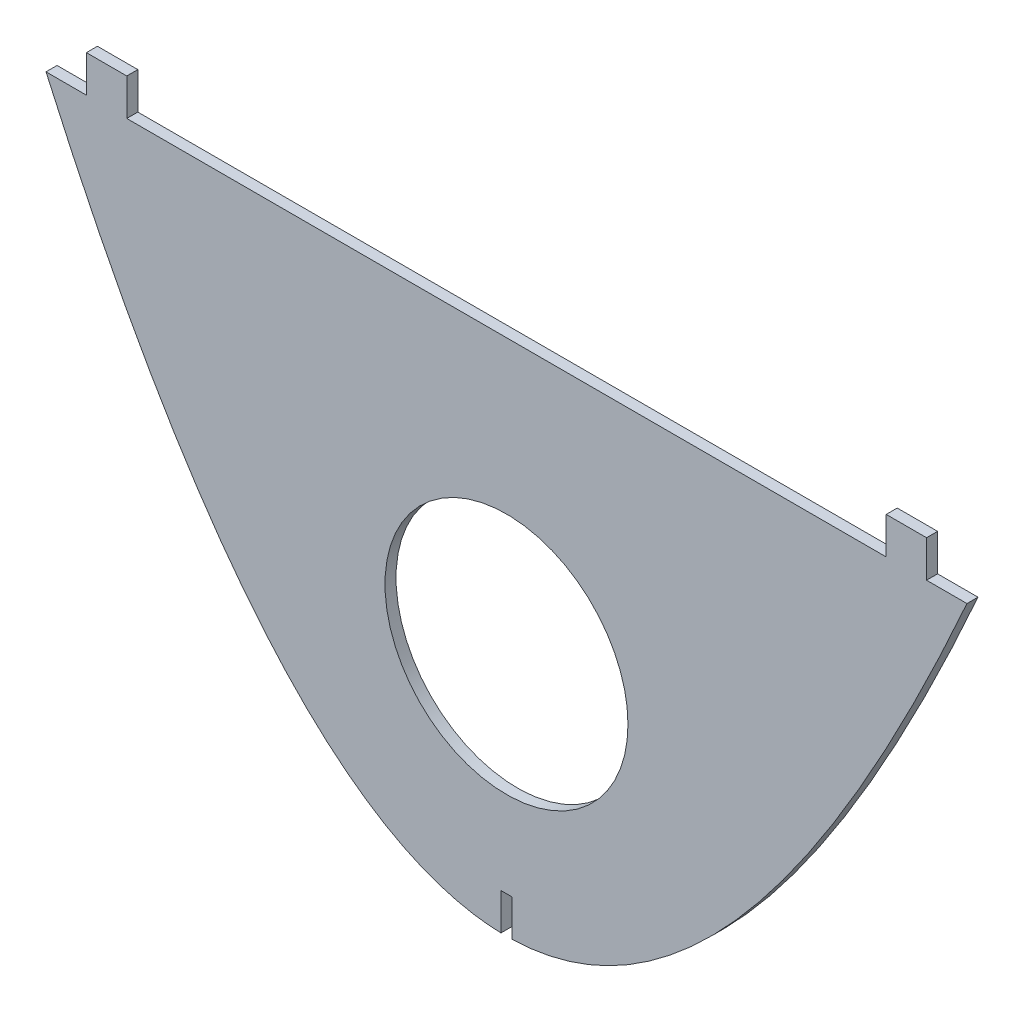
from build123d import *

# Parameters (mm, degrees)
BOSS_EXTRUDE1_DEPTH = 3
SKETCH2_W           = 3
SKETCH2_H           = 14.324437629
CUT_EXTRUDE1_DEPTH  = 13
SKETCH3_R           = 33
CUT_EXTRUDE2_DEPTH  = 196.94408514


with BuildPart() as part:
    # Sketch1 → Boss-Extrude1 (new body)
    with BuildSketch(Plane.XY):
        with BuildLine():
            Line((-125.077753597, 140.800000003), (-114.108233468, 140.800000003))
            Line((-114.108233468, 140.800000003), (-114.108233468, 150.800000003))
            Line((-114.108233468, 150.800000003), (-103.138713339, 150.800000003))
            Line((-103.138713339, 150.800000003), (-103.138713339, 140.800000002))
            Line((-103.138713339, 140.800000002), (103.138713339, 140.800000002))
            Line((103.138713339, 140.800000002), (103.138713339, 150.800000002))
            Line((103.138713339, 150.800000002), (114.108233466, 150.800000002))
            Line((114.108233466, 150.800000002), (114.108233466, 140.799999999))
            Line((114.108233466, 140.799999999), (125.077753595, 140.799999999))
            add(Edge.make_bspline(
                [(-125.077753597, 140.800000003), (-1e-09, -140.800000001), (125.077753595, 140.799999999)],
                knots=[0.054381513, 0.054381513, 0.054381513, 0.945618487, 0.945618487, 0.945618487], degree=2))
        make_face()
    extrude(amount=BOSS_EXTRUDE1_DEPTH)

    # Sketch2 → Cut-Extrude1 (cut)
    with BuildSketch(Plane.XY):
        with Locations((0, 2.837781185)):
            Rectangle(SKETCH2_W, SKETCH2_H)
    extrude(amount=CUT_EXTRUDE1_DEPTH, mode=Mode.SUBTRACT)

    # Sketch3 → Cut-Extrude2 (cut, through all)
    with BuildSketch(Plane.XY):
        with Locations((0, 66.335470002)):
            Circle(SKETCH3_R)
    extrude(amount=CUT_EXTRUDE2_DEPTH, mode=Mode.SUBTRACT)


solid = part.part
